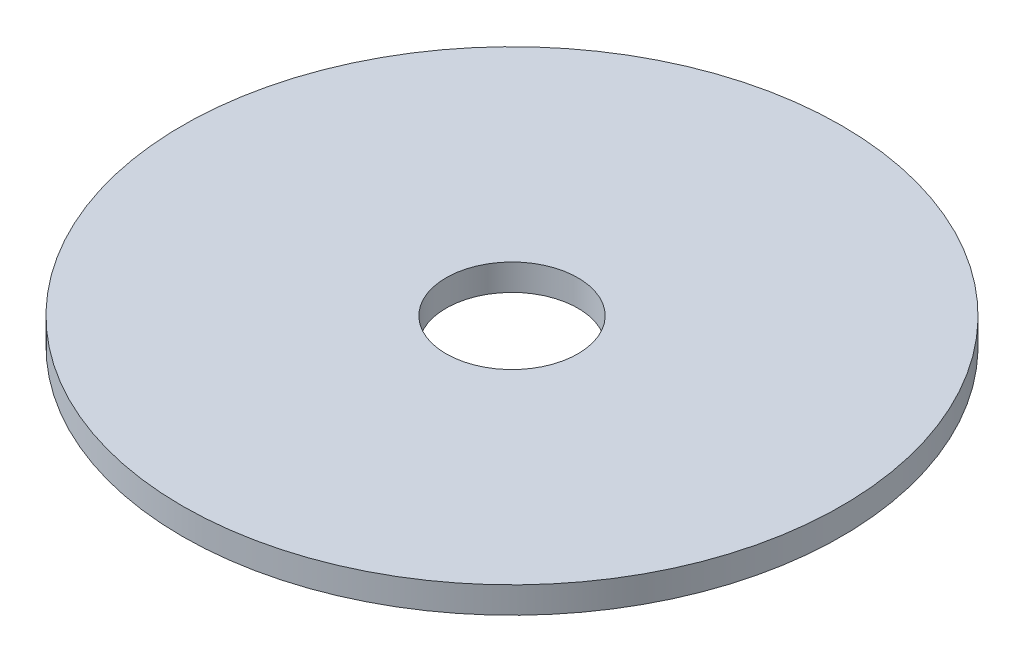
from build123d import *

# Parameters (mm, degrees)
SKETCH_1_R             = 25
SKETCH_1_R_2           = 5
SM_BASE_FLANGE_1_DEPTH = 2


# Sheet-metal steps are written as plain solids
with BuildPart() as part:
    # Sketch 1 → 基体-法兰1 (new body)
    with BuildSketch(Plane(origin=(0, 0, 0), x_dir=(1, 0, 0), z_dir=(0, 1, 0))):
        with Locations(Location((0, 0, 0), (0, 0, 270))):
            Circle(SKETCH_1_R)
        with Locations(Location((0, 0, 0), (0, 0, 270))):
            Circle(SKETCH_1_R_2, mode=Mode.SUBTRACT)
    extrude(amount=-SM_BASE_FLANGE_1_DEPTH)


solid = part.part
